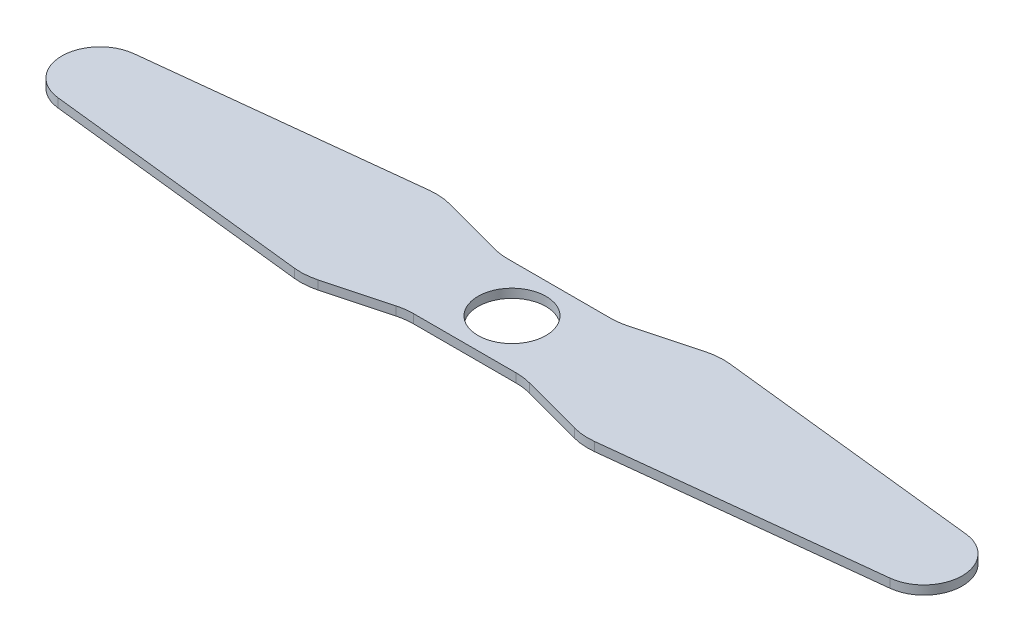
from build123d import *

# Parameters (mm, degrees)
LOFT1_START        = -0.9525
LOFT1_DEPTH        = 1.905
CUT_EXTRUDE2_DEPTH = 110.33494104
SKETCH5_R          = 7.3025
CUT_EXTRUDE3_DEPTH = 108.939694094


with BuildPart() as part:
    # Loft1: read off the stored shape, not the designer's step
    # Loft1 outline → Loft1 (new body)
    with BuildSketch(Plane(origin=(0, 0, 0), x_dir=(1, 0, 0), z_dir=(0, 1, 0)).offset(LOFT1_START)):
        with BuildLine():
            add(Edge.make_bspline(
                [(0, -15.875), (21.314656151, -21.106845313), (57.417925413, -25.838728987), (92.603989484, -17.720178647), (106.934, -10.795)],
                knots=[0, 0, 0, 0, 0.588632913, 1, 1, 1, 1], degree=3))
            Line((106.934, -10.795), (106.934, 10.795))
            add(Edge.make_bspline(
                [(0, 15.875), (21.314656151, 21.106845313), (57.417925413, 25.838728987), (92.603989484, 17.720178647), (106.934, 10.795)],
                knots=[0, 0, 0, 0, 0.588632913, 1, 1, 1, 1], degree=3))
            Line((0, 15.875), (0, -15.875))
        make_face()
    extrude(amount=LOFT1_DEPTH)

    # Sketch4 → Cut-Extrude2 (cut, through all)
    with BuildSketch(Plane(origin=(0, 0.9525, 0), x_dir=(1, 0, 0), z_dir=(0, 1, 0))):
        with BuildLine():
            Line((0, 15.875), (0, 3e-09))
            ThreePointArc((0, 3e-09), (2.975795104, 7.184204898), (10.16, 10.16))
            Line((10.16, 10.16), (21.188013281, 10.16))
            ThreePointArc((21.188013281, 10.16), (22.845695922, 10.268650261), (24.475015153, 10.592742006))
            Line((24.475015153, 10.592742006), (37.72679711, 14.14354628))
            ThreePointArc((37.72679711, 14.14354628), (40.05104351, 14.539743655), (42.408472673, 14.499476682))
            Line((42.408472673, 14.499476682), (99.60820705, 8.179760764))
            ThreePointArc((99.60820705, 8.179760764), (104.834824793, 5.490348999), (106.934, 0))
            Line((106.934, 0), (106.934, 10.795))
            add(Edge.make_bspline(
                [(0, 15.875), (21.314656151, 21.106845313), (57.417925413, 25.838728987), (92.603989484, 17.720178647), (106.934, 10.795)],
                knots=[0, 0, 0, 0, 0.588632913, 1, 1, 1, 1], degree=3))
        make_face()
        with BuildLine():
            Line((21.188013281, -10.16), (10.16, -10.16))
            ThreePointArc((10.16, -10.16), (2.975795102, -7.184204896), (0, 3e-09))
            Line((0, 3e-09), (0, -15.875))
            add(Edge.make_bspline(
                [(0, -15.875), (21.314656151, -21.106845313), (57.417925413, -25.838728987), (92.603989484, -17.720178647), (106.934, -10.795)],
                knots=[0, 0, 0, 0, 0.588632913, 1, 1, 1, 1], degree=3))
            Line((106.934, -10.795), (106.934, 0))
            ThreePointArc((106.934, 0), (104.834824793, -5.490348999), (99.60820705, -8.179760764))
            Line((99.60820705, -8.179760764), (42.408472673, -14.499476682))
            ThreePointArc((42.408472673, -14.499476682), (40.05104351, -14.539743655), (37.72679711, -14.14354628))
            Line((37.72679711, -14.14354628), (24.475015153, -10.592742006))
            ThreePointArc((24.475015153, -10.592742006), (22.845695922, -10.268650261), (21.188013281, -10.16))
        make_face()
    extrude(amount=-CUT_EXTRUDE2_DEPTH, mode=Mode.SUBTRACT)

    # Sketch5 → Cut-Extrude3 (cut, through all)
    with BuildSketch(Plane(origin=(0, 0.9525, 0), x_dir=(1, 0, 0), z_dir=(0, 1, 0))):
        with Locations(Location((10.16, 0, 0), (0, 0, 270))):
            Circle(SKETCH5_R)
    extrude(amount=-CUT_EXTRUDE3_DEPTH, mode=Mode.SUBTRACT)

    # Mirror1: part across plane


with BuildPart() as part_1:
    add(part.part)
    add(part.part.mirror(Plane(origin=(10.16, 0, 0), x_dir=(0, 0, 1), z_dir=(1, 0, 0))))


solid = part_1.part
